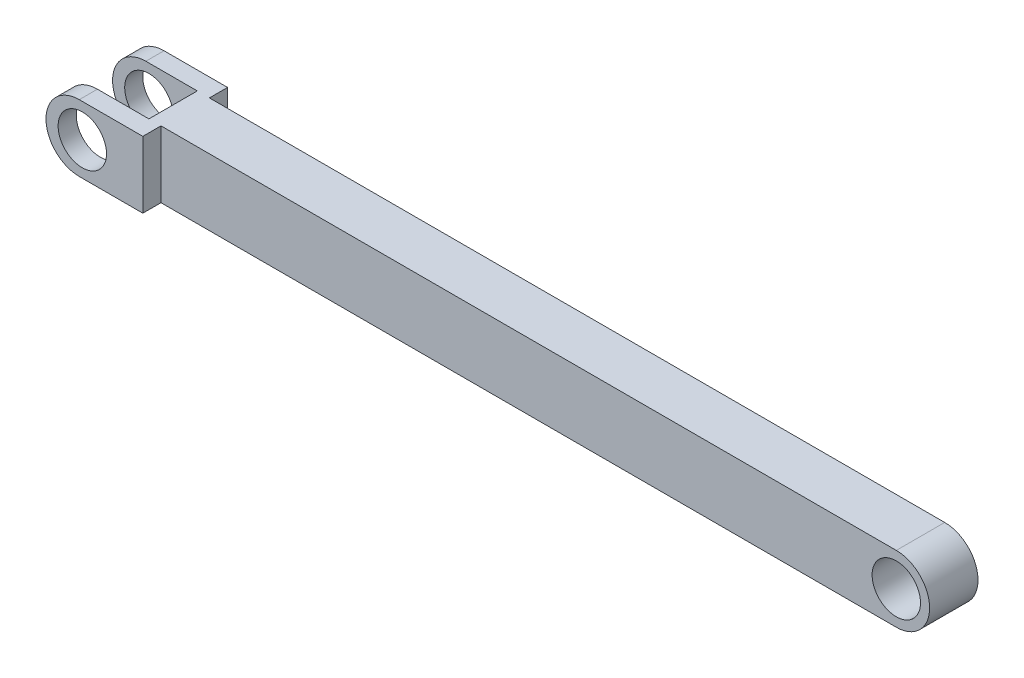
from build123d import *

# Parameters (mm, degrees)
SKETCH1_R               = 2
BOSS_EXTRUDE1_DEPTH     = 4
SKETCH2_W               = 7
SKETCH2_H               = 5.5
BOSS_EXTRUDE2_DEPTH     = 8
CUT_EXTRUDE1_DEPTH      = 70.024452189
CUT_EXTRUDE1_DEPTH_BACK = 70.024452189
SKETCH4_W               = 7
SKETCH4_H               = 4
CUT_EXTRUDE2_DEPTH      = 70.024452189
CUT_EXTRUDE2_DEPTH_BACK = 70.024452189
SKETCH5_R               = 2
FILLET1_R               = 2.75


with BuildPart() as part:
    # Sketch1 → Boss-Extrude1 (new body)
    with BuildSketch(Plane.XY):
        with BuildLine():
            Line((0, 2.75), (-60.75, 2.75))
            Line((-60.75, 2.75), (-60.75, -2.75))
            Line((-60.75, -2.75), (0, -2.75))
            ThreePointArc((0, -2.75), (2.75, 0), (0, 2.75))
        make_face()
        Circle(SKETCH1_R, mode=Mode.SUBTRACT)
    extrude(amount=BOSS_EXTRUDE1_DEPTH)

    # Sketch2 → Boss-Extrude2 (add)
    with BuildSketch(Plane.ZY.offset(60.75)):
        with Locations((2, 0)):
            Rectangle(SKETCH2_W, SKETCH2_H)
    extrude(amount=BOSS_EXTRUDE2_DEPTH)

    # Sketch4 → Cut-Extrude1 (cut, two sides: drawn at the far end of the back side and taken through both)
    with BuildSketch(Plane(origin=(0, 0, 0), x_dir=(1, 0, 0), z_dir=(0, 1, 0)).offset(-CUT_EXTRUDE1_DEPTH_BACK)):
        with Locations((-65.25, -2)):
            Rectangle(SKETCH4_W, SKETCH4_H)
    extrude(amount=CUT_EXTRUDE1_DEPTH + CUT_EXTRUDE1_DEPTH_BACK, mode=Mode.SUBTRACT)

    # Sketch5 → Cut-Extrude2 (cut, two sides: drawn at the far end of the back side and taken through both)
    with BuildSketch(Plane.XY.offset(-CUT_EXTRUDE2_DEPTH_BACK)):
        with Locations((-65.75, 0)):
            Circle(SKETCH5_R)
    extrude(amount=CUT_EXTRUDE2_DEPTH + CUT_EXTRUDE2_DEPTH_BACK, mode=Mode.SUBTRACT)

    # Fillet1
    fillet1_edges = [part.edges().sort_by_distance(p)[0] for p in [
        (-68.75, -2.75, 4.75),
        (-68.75, -2.75, -0.75),
        (-68.75, 2.75, -0.75),
        (-68.75, 2.75, 4.75),
    ]]
    fillet(fillet1_edges, radius=FILLET1_R - 0.0001)  # a hair under: the kernel refuses the full size


solid = part.part
